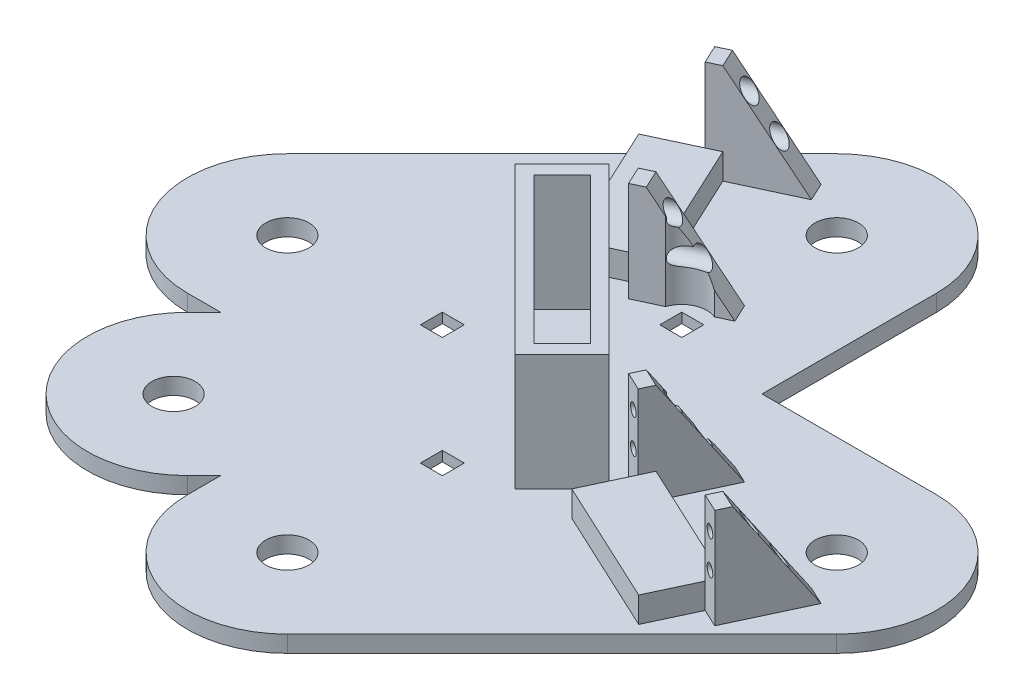
from build123d import *

# Parameters (mm, degrees)
BOSS_EXTRU_1_DEPTH           = 5
ESQUISSE2_R                  = 6.5
ENL_V_MAT_EXTRU_1_DEPTH      = 160.073548788
ENL_V_MAT_EXTRU_2_DEPTH      = 2
ESQUISSE4_R                  = 3.25
ENL_V_MAT_EXTRU_3_DEPTH      = 160.073548788
ESQUISSE5_W                  = 6.6
ESQUISSE5_H                  = 6.6
ENL_V_MAT_EXTRU_4_DEPTH      = 160.073548788
R_P_TITION_CIRCULAIRE1_COUNT = 4
BOSS_EXTRU_2_DEPTH           = 35
ESQUISSE7_R                  = 3.25
ENL_V_MAT_EXTRU_5_DEPTH      = 174.664310989
ENL_V_MAT_EXTRU_6_REACH      = 175.664
ESQUISSE8_W                  = 6.6
ESQUISSE8_H                  = 6.6
ENL_V_MAT_EXTRU_7_DEPTH      = 174.664310989
BOSS_EXTRU_3_DEPTH           = 30
BOSS_EXTRU_4_DEPTH           = 7.644
BOSS_EXTRU_5_DEPTH           = 30
ENL_V_MAT_EXTRU_8_REACH      = 251.864
ESQUISSE14_R                 = 1.75
ENL_V_MAT_EXTRU_9_DEPTH      = 169.803701186
ESQUISSE15_R                 = 2.9
ENL_V_MAT_EXTRU_10_DEPTH     = 169.803701186
ESQUISSE16_R                 = 7.5
ENL_V_MAT_EXTRU_12_DEPTH     = 30


# Read off the part's stored shape, not the designer's step: Symétrie2
with BuildPart() as part:
    # Esquisse1 → Boss.-Extru.1 (new body)
    with BuildSketch(Plane(origin=(0, 0, 0), x_dir=(1, 0, 0), z_dir=(0, 1, 0))):
        with BuildLine():
            Line((-35, -77.426406871), (-30, -72.426406871))
            Line((-30, -72.426406871), (-30, -30))
            Line((-30, -30), (-72.426406871, -30))
            Line((-72.426406871, -30), (-77.426406871, -35))
            ThreePointArc((-77.426406871, -35), (-77.426406871, -77.426406871), (-35, -77.426406871))
        make_face()
        with BuildLine():
            Line((-82.426406871, -30), (-72.426406871, -30))
            Line((-72.426406871, -30), (-30, 12.426406871))
            Line((-30, 12.426406871), (-30, 30))
            Line((-30, 30), (-82.426406871, 30))
            ThreePointArc((-82.426406871, 30), (-93.906909842, 27.716385975), (-103.639610307, 21.213203436))
            ThreePointArc((-103.639610307, 21.213203436), (-110.142792847, -11.480502971), (-82.426406871, -30))
        make_face()
        with BuildLine():
            ThreePointArc((-30, 82.426406871), (-27.716385975, 93.906909842), (-21.213203436, 103.639610307))
            Line((-21.213203436, 103.639610307), (-103.639610307, 21.213203436))
            ThreePointArc((-103.639610307, 21.213203436), (-93.906909842, 27.716385975), (-82.426406871, 30))
            Line((-82.426406871, 30), (-30, 30))
            Line((-30, 30), (-30, 82.426406871))
        make_face()
        with BuildLine():
            ThreePointArc((-1.213203436, 29.975458919), (0, 30), (1.213203436, 29.975458919))
            ThreePointArc((1.213203436, 29.975458919), (1.81968106, 29.993864102), (2.426406871, 30))
            Line((2.426406871, 30), (30, 30))
            Line((30, 30), (30, 82.426406871))
            ThreePointArc((30, 82.426406871), (11.480502971, 110.142792847), (-21.213203436, 103.639610307))
            ThreePointArc((-21.213203436, 103.639610307), (-27.716385975, 93.906909842), (-30, 82.426406871))
            Line((-30, 82.426406871), (-30, 30))
            Line((-30, 30), (-2.426406871, 30))
            ThreePointArc((-2.426406871, 30), (-1.81968106, 29.993864102), (-1.213203436, 29.975458919))
        make_face()
        with BuildLine():
            ThreePointArc((-21.213203436, 21.213203436), (-12.038696424, 27.478533229), (-1.213203436, 29.975458919))
            ThreePointArc((-1.213203436, 29.975458919), (-1.81968106, 29.993864102), (-2.426406871, 30))
            Line((-2.426406871, 30), (-30, 30))
            Line((-30, 30), (-30, 12.426406871))
            Line((-30, 12.426406871), (-21.213203436, 21.213203436))
        make_face()
        with BuildLine():
            ThreePointArc((-29.901714829, 0), (-26.857631607, 10.94025406), (-19.965279452, 19.965279452))
            ThreePointArc((-19.965279452, 19.965279452), (-10.94025406, 26.857631607), (0, 29.901714829))
            ThreePointArc((0, 29.901714829), (-0.606228214, 29.944731584), (-1.213203436, 29.975458919))
            ThreePointArc((-1.213203436, 29.975458919), (-12.038696424, 27.478533229), (-21.213203436, 21.213203436))
            Line((-21.213203436, 21.213203436), (-30, 12.426406871))
            Line((-30, 12.426406871), (-30, 2.426406871))
            ThreePointArc((-30, 2.426406871), (-29.975418636, 1.212208547), (-29.901714829, 0))
        make_face()
        with BuildLine():
            Line((-72.426406871, -30), (-30, -30))
            Line((-30, -30), (-30, -2.426406871))
            ThreePointArc((-30, -2.426406871), (-29.975418636, -1.212208547), (-29.901714829, 0))
            ThreePointArc((-29.901714829, 0), (-29.975418636, 1.212208547), (-30, 2.426406871))
            Line((-30, 2.426406871), (-30, 12.426406871))
            Line((-30, 12.426406871), (-72.426406871, -30))
        make_face()
        with BuildLine():
            ThreePointArc((-2.426406871, -30), (-1.212208547, -29.975418636), (0, -29.901714829))
            ThreePointArc((0, -29.901714829), (-10.94025406, -26.857631607), (-19.965279452, -19.965279452))
            ThreePointArc((-19.965279452, -19.965279452), (-26.857631607, -10.94025406), (-29.901714829, 0))
            ThreePointArc((-29.901714829, 0), (-29.975418636, -1.212208547), (-30, -2.426406871))
            Line((-30, -2.426406871), (-30, -30))
            Line((-30, -30), (-2.426406871, -30))
        make_face()
        with BuildLine():
            Line((-30, -72.426406871), (12.426406871, -30))
            Line((12.426406871, -30), (2.426406871, -30))
            ThreePointArc((2.426406871, -30), (1.212208547, -29.975418636), (0, -29.901714829))
            ThreePointArc((0, -29.901714829), (-1.212208547, -29.975418636), (-2.426406871, -30))
            Line((-2.426406871, -30), (-30, -30))
            Line((-30, -30), (-30, -72.426406871))
        make_face()
        with BuildLine():
            ThreePointArc((21.213203436, -21.213203436), (27.478533229, -12.038696424), (29.975458919, -1.213203436))
            ThreePointArc((29.975458919, -1.213203436), (29.944731584, -0.606228214), (29.901714829, 0))
            ThreePointArc((29.901714829, 0), (26.857631607, -10.94025406), (19.965279452, -19.965279452))
            ThreePointArc((19.965279452, -19.965279452), (10.94025406, -26.857631607), (0, -29.901714829))
            ThreePointArc((0, -29.901714829), (1.212208547, -29.975418636), (2.426406871, -30))
            Line((2.426406871, -30), (12.426406871, -30))
            Line((12.426406871, -30), (21.213203436, -21.213203436))
        make_face()
        with BuildLine():
            Line((30, -30), (30, -2.426406871))
            ThreePointArc((30, -2.426406871), (29.993864102, -1.81968106), (29.975458919, -1.213203436))
            ThreePointArc((29.975458919, -1.213203436), (27.478533229, -12.038696424), (21.213203436, -21.213203436))
            Line((21.213203436, -21.213203436), (12.426406871, -30))
            Line((12.426406871, -30), (30, -30))
        make_face()
        with BuildLine():
            ThreePointArc((1.213203436, 29.975458919), (21.213203436, 21.213203436), (29.975458919, 1.213203436))
            ThreePointArc((29.975458919, 1.213203436), (29.993864102, 1.81968106), (30, 2.426406871))
            Line((30, 2.426406871), (30, 30))
            Line((30, 30), (2.426406871, 30))
            ThreePointArc((2.426406871, 30), (1.81968106, 29.993864102), (1.213203436, 29.975458919))
        make_face()
        with BuildLine():
            ThreePointArc((-19.965279452, 19.965279452), (0, 27.573593129), (19.965279452, 19.965279452))
            ThreePointArc((19.965279452, 19.965279452), (10.94025406, 26.857631607), (0, 29.901714829))
            ThreePointArc((0, 29.901714829), (-10.94025406, 26.857631607), (-19.965279452, 19.965279452))
        make_face()
        with BuildLine():
            ThreePointArc((-19.965279452, -19.965279452), (-27.573593129, 0), (-19.965279452, 19.965279452))
            ThreePointArc((-19.965279452, 19.965279452), (-26.857631607, 10.94025406), (-29.901714829, 0))
            ThreePointArc((-29.901714829, 0), (-26.857631607, -10.94025406), (-19.965279452, -19.965279452))
        make_face()
        with BuildLine():
            ThreePointArc((0, -29.901714829), (10.94025406, -26.857631607), (19.965279452, -19.965279452))
            ThreePointArc((19.965279452, -19.965279452), (0, -27.573593129), (-19.965279452, -19.965279452))
            ThreePointArc((-19.965279452, -19.965279452), (-10.94025406, -26.857631607), (0, -29.901714829))
        make_face()
        with BuildLine():
            Line((30, -82.426406871), (30, -30))
            Line((30, -30), (12.426406871, -30))
            Line((12.426406871, -30), (-30, -72.426406871))
            Line((-30, -72.426406871), (-30, -82.426406871))
            ThreePointArc((-30, -82.426406871), (-11.480502971, -110.142792847), (21.213203436, -103.639610307))
            ThreePointArc((21.213203436, -103.639610307), (27.716385975, -93.906909842), (30, -82.426406871))
        make_face()
        with BuildLine():
            ThreePointArc((29.975458919, -1.213203436), (29.993864102, -1.81968106), (30, -2.426406871))
            Line((30, -2.426406871), (30, -30))
            Line((30, -30), (82.426406871, -30))
            ThreePointArc((82.426406871, -30), (93.906909842, -27.716385975), (103.639610307, -21.213203436))
            ThreePointArc((103.639610307, -21.213203436), (110.142792847, 11.480502971), (82.426406871, 30))
            Line((82.426406871, 30), (30, 30))
            Line((30, 30), (30, 2.426406871))
            ThreePointArc((30, 2.426406871), (29.993864102, 1.81968106), (29.975458919, 1.213203436))
            ThreePointArc((29.975458919, 1.213203436), (30, 0), (29.975458919, -1.213203436))
        make_face()
        with BuildLine():
            Line((82.426406871, -30), (30, -30))
            Line((30, -30), (30, -82.426406871))
            ThreePointArc((30, -82.426406871), (27.716385975, -93.906909842), (21.213203436, -103.639610307))
            Line((21.213203436, -103.639610307), (103.639610307, -21.213203436))
            ThreePointArc((103.639610307, -21.213203436), (93.906909842, -27.716385975), (82.426406871, -30))
        make_face()
        with BuildLine():
            ThreePointArc((19.965279452, -19.965279452), (27.573593129, 0), (19.965279452, 19.965279452))
            ThreePointArc((19.965279452, 19.965279452), (0, 27.573593129), (-19.965279452, 19.965279452))
            ThreePointArc((-19.965279452, 19.965279452), (-27.573593129, 0), (-19.965279452, -19.965279452))
            ThreePointArc((-19.965279452, -19.965279452), (0, -27.573593129), (19.965279452, -19.965279452))
        make_face()
        with BuildLine():
            ThreePointArc((19.965279452, -19.965279452), (26.857631607, -10.94025406), (29.901714829, 0))
            ThreePointArc((29.901714829, 0), (26.857631607, 10.94025406), (19.965279452, 19.965279452))
            ThreePointArc((19.965279452, 19.965279452), (27.573593129, 0), (19.965279452, -19.965279452))
        make_face()
        with BuildLine():
            ThreePointArc((19.965279452, 19.965279452), (26.857631607, 10.94025406), (29.901714829, 0))
            ThreePointArc((29.901714829, 0), (29.944731584, 0.606228214), (29.975458919, 1.213203436))
            ThreePointArc((29.975458919, 1.213203436), (21.213203436, 21.213203436), (1.213203436, 29.975458919))
            ThreePointArc((1.213203436, 29.975458919), (0.606228214, 29.944731584), (0, 29.901714829))
            ThreePointArc((0, 29.901714829), (10.94025406, 26.857631607), (19.965279452, 19.965279452))
        make_face()
        with BuildLine():
            ThreePointArc((0, 29.901714829), (0.606228214, 29.944731584), (1.213203436, 29.975458919))
            ThreePointArc((1.213203436, 29.975458919), (0, 30), (-1.213203436, 29.975458919))
            ThreePointArc((-1.213203436, 29.975458919), (-0.606228214, 29.944731584), (0, 29.901714829))
        make_face()
        with BuildLine():
            ThreePointArc((29.901714829, 0), (29.944731584, -0.606228214), (29.975458919, -1.213203436))
            ThreePointArc((29.975458919, -1.213203436), (30, 0), (29.975458919, 1.213203436))
            ThreePointArc((29.975458919, 1.213203436), (29.944731584, 0.606228214), (29.901714829, 0))
        make_face()
    extrude(amount=BOSS_EXTRU_1_DEPTH)

    # Esquisse2 → Enlèv. mat.-Extru.1 (cut, through all)
    with BuildSketch(Plane.XZ):
        with Locations(Location((82.426406871, 0, 0), (0, 0, 270))):
            Circle(ESQUISSE2_R)
        with Locations(Location((0, -82.426406871, 0), (0, 0, 270))):
            Circle(ESQUISSE2_R)
        with Locations(Location((-82.426406871, 0, 0), (0, 0, 270))):
            Circle(ESQUISSE2_R)
        with Locations(Location((-58.284271247, 58.284271247, 0), (0, 0, 270))):
            Circle(ESQUISSE2_R)
        with Locations(Location((0, 82.426406871, 0), (0, 0, 270))):
            Circle(ESQUISSE2_R)
    extrude(amount=-ENL_V_MAT_EXTRU_1_DEPTH, mode=Mode.SUBTRACT)

    # Esquisse3 → Enlèv. mat.-Extru.2 (cut)
    with BuildSketch(Plane.XZ):
        with BuildLine():
            Line((50.80363027, 15), (25.80363027, 15))
            Line((25.80363027, 15), (25.80363027, -15))
            Line((25.80363027, -15), (50.80363027, -15))
            ThreePointArc((50.80363027, -15), (47.426406871, 0), (50.80363027, 15))
        make_face()
        with BuildLine():
            Line((-15, -25.80363027), (-15, -50.80363027))
            ThreePointArc((-15, -50.80363027), (0, -47.426406871), (15, -50.80363027))
            Line((15, -50.80363027), (15, -25.80363027))
            Line((15, -25.80363027), (-15, -25.80363027))
        make_face()
        with BuildLine():
            Line((-25.80363027, 15), (-50.80363027, 15))
            ThreePointArc((-50.80363027, 15), (-47.426406871, 0), (-50.80363027, -15))
            Line((-50.80363027, -15), (-25.80363027, -15))
            Line((-25.80363027, -15), (-25.80363027, 15))
        make_face()
        with BuildLine():
            Line((15, 25.80363027), (15, 50.80363027))
            ThreePointArc((15, 50.80363027), (0, 47.426406871), (-15, 50.80363027))
            Line((-15, 50.80363027), (-15, 25.80363027))
            Line((-15, 25.80363027), (15, 25.80363027))
        make_face()
    extrude(amount=-ENL_V_MAT_EXTRU_2_DEPTH, mode=Mode.SUBTRACT)

    # Esquisse4 → Enlèv. mat.-Extru.3 (cut, through all)
    with BuildSketch(Plane(origin=(0, 5, 0), x_dir=(1, 0, 0), z_dir=(0, 1, 0))):
        with Locations(Location((35.926406871, 0, 0), (0, 0, 270))):
            Circle(ESQUISSE4_R)
    extrude(amount=-ENL_V_MAT_EXTRU_3_DEPTH, mode=Mode.SUBTRACT)

    # Esquisse5 → Enlèv. mat.-Extru.4 (cut, through all)
    with BuildSketch(Plane(origin=(0, 5, 0), x_dir=(1, 0, 0), z_dir=(0, 1, 0))):
        with Locations((35.926406871, 0)):
            Rectangle(ESQUISSE5_W, ESQUISSE5_H)
    enl_v_mat_extru_4 = extrude(amount=-ENL_V_MAT_EXTRU_4_DEPTH, mode=Mode.SUBTRACT)

    # Répétition circulaire1: Enlèv. mat.-Extru.4 ×4 about axis
    r_p_tition_circulaire1_axis = Axis((0, 0, 0), (0, 1, 0))
    for i in range(1, R_P_TITION_CIRCULAIRE1_COUNT):
        add(enl_v_mat_extru_4.rotate(r_p_tition_circulaire1_axis, i * 360 / R_P_TITION_CIRCULAIRE1_COUNT), mode=Mode.SUBTRACT)

    # Esquisse6 → Boss.-Extru.2 (add)
    with BuildSketch(Plane(origin=(0, 5, 0), x_dir=(1, 0, 0), z_dir=(0, 1, 0))):
        Polygon((31.819805153, -17.67766953), (-17.67766953, 31.819805153), (-31.819805153, 17.67766953), (17.67766953, -31.819805153), align=None)
        Polygon((17.67766953, -26.162950904), (26.162950904, -17.67766953), (-17.67766953, 26.162950904), (-26.162950904, 17.67766953), align=None, mode=Mode.SUBTRACT)
    extrude(amount=BOSS_EXTRU_2_DEPTH)

    # Esquisse7 → Enlèv. mat.-Extru.5 (cut, through all)
    with BuildSketch(Plane(origin=(7.071067812, 0, -7.071067812), x_dir=(-0.7071067811865506, 0, -0.7071067811865446), z_dir=(0.7071067811865446, 0, -0.7071067811865506))):
        with Locations((0, 34)):
            Circle(ESQUISSE7_R)
    extrude(amount=-ENL_V_MAT_EXTRU_5_DEPTH, mode=Mode.SUBTRACT)

    # Esquisse8 → Enlèv. mat.-Extru.6 (cut, up to next)
    with BuildSketch(Plane(origin=(7.071067812, 0, -7.071067812), x_dir=(-0.7071067811865506, 0, -0.7071067811865446), z_dir=(0.7071067811865446, 0, -0.7071067811865506)), mode=Mode.PRIVATE) as enl_v_mat_extru_6_sk1:
        with Locations((0, 34)):
            Rectangle(ESQUISSE8_W, ESQUISSE8_H)
    enl_v_mat_extru_6_tool1 = extrude(enl_v_mat_extru_6_sk1.sketch, amount=-ENL_V_MAT_EXTRU_6_REACH, mode=Mode.PRIVATE) & part.part
    add(enl_v_mat_extru_6_tool1.solids().sort_by_distance((7.071068, 34, -7.071068))[0], mode=Mode.SUBTRACT)

    # Esquisse9 → Enlèv. mat.-Extru.7 (cut, through all)
    with BuildSketch(Plane(origin=(7.071067812, 0, -7.071067812), x_dir=(-0.7071067811865506, 0, -0.7071067811865446), z_dir=(0.7071067811865446, 0, -0.7071067811865506))):
        Polygon((-10, 10), (10, 10), (0, 20), align=None)
    extrude(amount=-ENL_V_MAT_EXTRU_7_DEPTH, mode=Mode.SUBTRACT)

    # Esquisse10 → Boss.-Extru.3 (add)
    with BuildSketch(Plane(origin=(0, 5, 0), x_dir=(1, 0, 0), z_dir=(0, 1, 0))):
        Polygon((83.178360102, -37.339841554), (77.74051338, -34.804131984), (79.430986427, -31.178900836), (84.868833149, -33.714610406), align=None)
        Polygon((34.690893496, -14.729764551), (40.128740218, -17.265474122), (41.819213265, -13.640242973), (36.381366543, -11.104533403), align=None)
    extrude(amount=BOSS_EXTRU_3_DEPTH)

    # Esquisse11 → Boss.-Extru.4 (add)
    with BuildSketch(Plane(origin=(0, 5, 0), x_dir=(1, 0, 0), z_dir=(0, 1, 0))):
        Polygon((79.430986427, -31.178900836), (41.819213265, -13.640242973), (33.789466292, -30.860090927), (71.401239454, -48.398748789), align=None)
    extrude(amount=BOSS_EXTRU_4_DEPTH)

    # Esquisse12 → Boss.-Extru.5 (add)
    with BuildSketch(Plane(origin=(0, 5, 0), x_dir=(1, 0, 0), z_dir=(0, 1, 0))):
        Polygon((84.868833149, -33.714610406), (93.321198384, -15.588454665), (87.883351662, -13.052745095), (79.430986427, -31.178900836), align=None)
        Polygon((36.381366543, -11.104533403), (41.819213265, -13.640242973), (50.2715785, 4.485912767), (44.833731777, 7.021622338), align=None)
    extrude(amount=BOSS_EXTRU_5_DEPTH)

    # Enlèv. mat.-Extru.8: up to this face of the body (flat: up to its plane)
    enl_v_mat_extru_8_end = Plane(part.part.faces().sort_by_distance((39.762312637, 20, 3.854071107))[0])
    # Esquisse13 → Enlèv. mat.-Extru.8 (cut, up to the picked face)
    with BuildSketch(Plane(origin=(82.62417875, 0, 38.5282873), x_dir=(0.4226182617406944, 0, -0.9063077870366524), z_dir=(0.9063077870366523, 0, 0.42261826174069433)), mode=Mode.PRIVATE) as enl_v_mat_extru_8_sk1:
        Polygon((25.311304793, 5), (25.311304793, 35), (5.311304793, 35), align=None)
    enl_v_mat_extru_8_tool1 = split(extrude(enl_v_mat_extru_8_sk1.sketch, amount=-ENL_V_MAT_EXTRU_8_REACH, mode=Mode.PRIVATE), bisect_by=enl_v_mat_extru_8_end, keep=Keep.BOTH, mode=Mode.PRIVATE)
    add(enl_v_mat_extru_8_tool1.solids().sort_by(Axis((90.503743, 25, 21.630507), (-0.9063077870366523, 0, -0.42261826174069433)))[0], mode=Mode.SUBTRACT)

    # Esquisse14 → Enlèv. mat.-Extru.9 (cut, symmetric)
    with BuildSketch(Plane(origin=(2.244654399, 0, -4.813676894), x_dir=(0.9063077870366515, 0, 0.42261826174069633), z_dir=(-0.4226182617406963, 0, 0.9063077870366514))):
        with Locations(Location((40.665694405, 27.63, 0), (0, 0, 90))):
            Circle(ESQUISSE14_R)
        with Locations(Location((40.665694405, 17.47, 0), (0, 0, 90))):
            Circle(ESQUISSE14_R)
    enl_v_mat_extru_9 = extrude(amount=ENL_V_MAT_EXTRU_9_DEPTH, both=True, mode=Mode.SUBTRACT)

    # Esquisse15 → Enlèv. mat.-Extru.10 (cut, through all)
    with BuildSketch(Plane(origin=(2.244654399, 0, -4.813676894), x_dir=(0.9063077870366515, 0, 0.42261826174069633), z_dir=(-0.4226182617406963, 0, 0.9063077870366514))):
        with Locations((40.665694405, 27.63)):
            Circle(ESQUISSE15_R)
        with Locations((40.665694405, 17.47)):
            Circle(ESQUISSE15_R)
    enl_v_mat_extru_10 = extrude(amount=-ENL_V_MAT_EXTRU_10_DEPTH, mode=Mode.SUBTRACT)

    # Symétrie1: Enlèv. mat.-Extru.9, Enlèv. mat.-Extru.10 across plane
    add(enl_v_mat_extru_9.mirror(Plane(origin=(58.380445446, 0, 27.223248798), x_dir=(-0.42261826174069744, 0, 0.9063077870366509), z_dir=(0.906307787036651, 0, 0.4226182617406974))), mode=Mode.SUBTRACT)
    add(enl_v_mat_extru_10.mirror(Plane(origin=(58.380445446, 0, 27.223248798), x_dir=(-0.42261826174069744, 0, 0.9063077870366509), z_dir=(0.906307787036651, 0, 0.4226182617406974))), mode=Mode.SUBTRACT)

    # Esquisse16 → Enlèv. mat.-Extru.12 (cut)
    with BuildSketch(Plane(origin=(0, 5, 0), x_dir=(1, 0, 0), z_dir=(0, 1, 0))):
        with Locations((35.926406871, 0)):
            Circle(ESQUISSE16_R)
    extrude(amount=ENL_V_MAT_EXTRU_12_DEPTH, mode=Mode.SUBTRACT)

    # Symétrie2: part across plane


with BuildPart() as part_1:
    add(part.part)
    add(part.part.mirror(Plane(origin=(0, 0, 0), x_dir=(-0.7071067811865478, 0, 0.7071067811865472), z_dir=(0.7071067811865475, 0, 0.7071067811865477))))


solid = part_1.part
